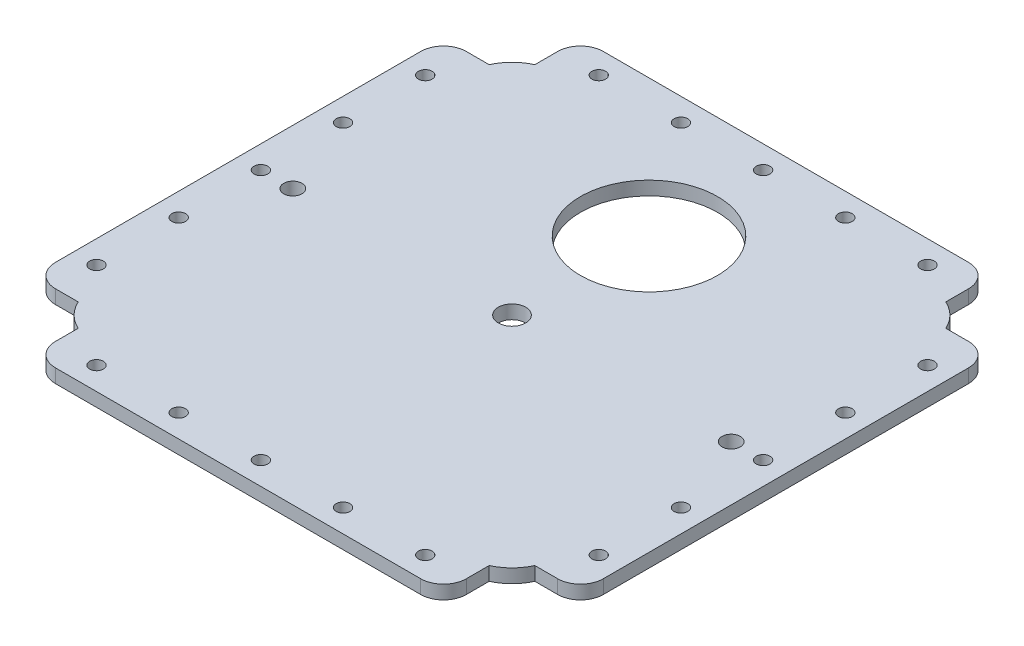
from build123d import *

# Parameters (mm, degrees)
SKETCH_1_W          = 120
SKETCH_1_H          = 120
SKETCH_1_R          = 3
SKETCH_1_R_2        = 2
SKETCH_1_R_3        = 15
EXTRUDE_1_DEPTH     = 3
CUT_EXTRUDE_1_DEPTH = 85.905830189
FILLET_1_R          = 10
FILLET_2_R          = 5
SKETCH_4_R          = 1.5
CUT_EXTRUDE_2_DEPTH = 85.905830189


with BuildPart() as part:
    # Эскиз1 → Бобышка-Вытянуть1 (new body)
    with BuildSketch(Plane(origin=(0, 0, 0), x_dir=(1, 0, 0), z_dir=(0, 1, 0))):
        Rectangle(SKETCH_1_W, SKETCH_1_H)
        with Locations(Location((0, 0, 0), (0, 0, 270))):
            Circle(SKETCH_1_R, mode=Mode.SUBTRACT)
        with Locations(Location((-48, 0, 0), (0, 0, 270))):
            Circle(SKETCH_1_R_2, mode=Mode.SUBTRACT)
        with Locations(Location((48, 0, 0), (0, 0, 90))):
            Circle(SKETCH_1_R_2, mode=Mode.SUBTRACT)
        with Locations(Location((0, 30, 0), (0, 0, 270))):
            Circle(SKETCH_1_R_3, mode=Mode.SUBTRACT)
    extrude(amount=EXTRUDE_1_DEPTH)

    # Эскиз3 → Вырез-Вытянуть1 (cut, through all)
    with BuildSketch(Plane(origin=(0, 3, 0), x_dir=(1, 0, 0), z_dir=(0, 1, 0))):
        Polygon((-60, 60), (-45, 60), (-45, 50), (-50, 50), (-50, 45), (-60, 45), align=None)
        Polygon((60, 45), (60, 60), (45, 60), (45, 50), (50, 50), (50, 45), align=None)
        Polygon((60, -60), (45, -60), (45, -50), (50, -50), (50, -45), (60, -45), align=None)
        Polygon((-60, -45), (-60, -60), (-45, -60), (-45, -50), (-50, -50), (-50, -45), align=None)
    extrude(amount=-CUT_EXTRUDE_1_DEPTH, mode=Mode.SUBTRACT)

    # Скругление1
    # the kernel refuses this fillet: 10 mm, written as the material it takes off along each edge
    with BuildSketch(Plane(origin=(50, 15.5, -50), x_dir=(0, 0, 1), z_dir=(0, -1, 0)), Plane(origin=(50, 15.5, 50), x_dir=(-1, 0, 0), z_dir=(0, -1, 0)), Plane(origin=(-50, 15.5, 50), x_dir=(0, 0, -1), z_dir=(0, -1, 0)), Plane(origin=(-50, 15.5, -50), x_dir=(1, 0, 0), z_dir=(0, -1, 0))) as fillet_1_piece_1:
        with BuildLine():
            CenterArc((9.114378278, 9.114378278), FILLET_1_R, 204.295188945, 41.409622109)
            Line((0, 5), (0, 0))
            Line((0, 0), (5, 0))
        make_face()
    extrude(amount=28, mode=Mode.SUBTRACT)

    # Скругление2
    fillet_2_edges = [part.edges().sort_by_distance(p)[0] for p in [
        (-60, 1.5, 45),
        (-45, 1.5, 60),
        (60, 1.5, 45),
        (45, 1.5, 60),
        (60, 1.5, -45),
        (45, 1.5, -60),
        (-60, 1.5, -45),
        (-45, 1.5, -60),
    ]]
    fillet(fillet_2_edges, radius=FILLET_2_R)

    # Эскиз4 → Вырез-Вытянуть2 (cut, through all)
    with BuildSketch(Plane(origin=(0, 3, 0), x_dir=(1, 0, 0), z_dir=(0, 1, 0))):
        with Locations(Location((0, 55, 0), (0, 0, 270))):
            Circle(SKETCH_4_R)
        with Locations(Location((18, 55, 0), (0, 0, 270))):
            Circle(SKETCH_4_R)
        with Locations(Location((36, 55, 0), (0, 0, 270))):
            Circle(SKETCH_4_R)
        with Locations(Location((-18, 55, 0), (0, 0, 270))):
            Circle(SKETCH_4_R)
        with Locations(Location((-36, 55, 0), (0, 0, 270))):
            Circle(SKETCH_4_R)
        with Locations(Location((55, 0, 0), (0, 0, 270))):
            Circle(SKETCH_4_R)
        with Locations(Location((55, -18, 0), (0, 0, 270))):
            Circle(SKETCH_4_R)
        with Locations(Location((55, -36, 0), (0, 0, 270))):
            Circle(SKETCH_4_R)
        with Locations(Location((55, 18, 0), (0, 0, 270))):
            Circle(SKETCH_4_R)
        with Locations(Location((55, 36, 0), (0, 0, 270))):
            Circle(SKETCH_4_R)
        with Locations(Location((0, -55, 0), (0, 0, 270))):
            Circle(SKETCH_4_R)
        with Locations(Location((-18, -55, 0), (0, 0, 270))):
            Circle(SKETCH_4_R)
        with Locations(Location((-36, -55, 0), (0, 0, 270))):
            Circle(SKETCH_4_R)
        with Locations(Location((18, -55, 0), (0, 0, 270))):
            Circle(SKETCH_4_R)
        with Locations(Location((36, -55, 0), (0, 0, 270))):
            Circle(SKETCH_4_R)
        with Locations(Location((-55, 0, 0), (0, 0, 270))):
            Circle(SKETCH_4_R)
        with Locations(Location((-55, 18, 0), (0, 0, 270))):
            Circle(SKETCH_4_R)
        with Locations(Location((-55, 36, 0), (0, 0, 270))):
            Circle(SKETCH_4_R)
        with Locations(Location((-55, -18, 0), (0, 0, 270))):
            Circle(SKETCH_4_R)
        with Locations(Location((-55, -36, 0), (0, 0, 270))):
            Circle(SKETCH_4_R)
    extrude(amount=-CUT_EXTRUDE_2_DEPTH, mode=Mode.SUBTRACT)


solid = part.part
